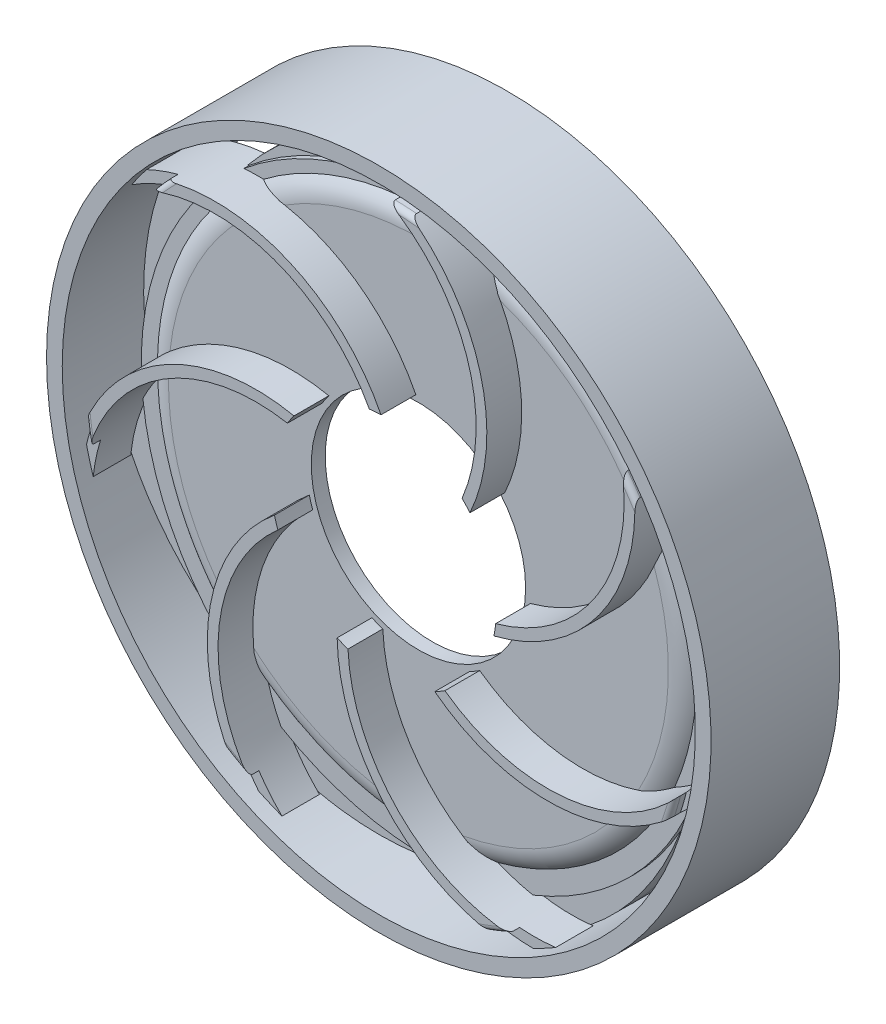
from build123d import *
from OCP.BRepFilletAPI import BRepFilletAPI_MakeChamfer
from build123d.topology import SkipClean

# Parameters (mm, degrees)
SKETCH1_R                 = 51
BOSS_EXTRUDE1_DEPTH       = 2.6
BOSS_EXTRUDE12_DEPTH      = 3.5
BOSS_EXTRUDE12_2_DEPTH    = 3.5
BOSS_EXTRUDE12_3_DEPTH    = 3.5
BOSS_EXTRUDE12_4_DEPTH    = 3.5
BOSS_EXTRUDE12_5_DEPTH    = 3.5
BOSS_EXTRUDE12_6_DEPTH    = 3.5
BOSS_EXTRUDE12_7_DEPTH    = 3.5
SKETCH17_R                = 51.58295431034159
SKETCH17_R_2              = 51.00000000000001
BOSS_EXTRUDE17_DEPTH      = 3.55
BOSS_EXTRUDE18_DEPTH      = 8
CIRPATTERN9_COUNT         = 7
CHAMFER4_SIZE             = 8
CHAMFER4_SIZE_2           = 6
FILLET2_R                 = 5
BOSS_EXTRUDE19_DEPTH      = 2.5
BOSS_EXTRUDE19_DEPTH_BACK = 21.5
SKETCH19_R                = 62
SKETCH19_R_2              = 59.070129845213785
SKETCH20_R                = 20
CUT_EXTRUDE2_DEPTH        = 90.23878082605118
BOSS_EXTRUDE20_DEPTH      = 6.5
CIRPATTERN10_COUNT        = 7
BOSS_EXTRUDE21_DEPTH      = 3.5
CIRPATTERN11_COUNT        = 7
BOSS_EXTRUDE22_START      = -9.1
BOSS_EXTRUDE22_DEPTH      = 9.1
CIRPATTERN13_COUNT        = 7
SKETCH24_R                = 21.00534667736599
CUT_EXTRUDE3_DEPTH        = 12.6
CUT_EXTRUDE4_START        = -3
SKETCH25_R                = 59.070129845213785
SKETCH25_R_2              = 56.070129845213785
CUT_EXTRUDE4_DEPTH        = 3
FILLET3_R                 = 1
SKETCH26_R                = 52
CUT_EXTRUDE5_DEPTH        = 30
BOSS_EXTRUDE23_START      = -1
SKETCH27_R                = 53.32091751756544
SKETCH27_R_2              = 20
BOSS_EXTRUDE23_DEPTH      = 1


# Some blends are built 0.0001 mm under size
with BuildPart() as part:
    # Sketch1 → Boss-Extrude1 (new body)
    with BuildSketch(Plane.XY):
        Circle(SKETCH1_R)
    extrude(amount=BOSS_EXTRUDE1_DEPTH)



with BuildPart() as body_2:
    # Sketch13 → Boss-Extrude12 (new body)
    with BuildSketch(Plane(origin=(0, 0, 0), x_dir=(-1, 0, 0), z_dir=(0, 0, -1))):
        with BuildLine():
            ThreePointArc((-39.87340560586933, 31.797979894795645), (-22.128070694995337, 45.94941226302344), (3.12e-15, 51))
            add(Edge.make_bspline(
                [(0, 51), (-16.32188038629084, 53.8593825091432), (-34.590722993589566, 48.68202255750877), (-46.51897320684779, 37.097643210594654)],
                knots=[0, 0, 0, 0, 1, 1, 1, 1], degree=3))
            Line((-46.51897320684732, 37.097643210595216), (-39.873405605869145, 31.797979894795866))
        make_face()
    extrude(amount=BOSS_EXTRUDE12_DEPTH)


with BuildPart() as body_3:
    # Sketch13 → Boss-Extrude12 2 (new body)
    with BuildSketch(Plane(origin=(0, 0, 0), x_dir=(-1, 0, 0), z_dir=(0, 0, -1))):
        with BuildLine():
            ThreePointArc((-49.72132352127312, -11.348567631771543), (-49.721323521272915, 11.348567631772438), (-39.87340560586933, 31.797979894795645))
            add(Edge.make_bspline(
                [(-39.873405605869515, 31.797979894795407), (-52.2854868399465, 20.81981578977977), (-59.62810089110262, 3.308628360744432), (-58.00821077481851, -13.23999557040073)],
                knots=[0, 0, 0, 0, 1, 1, 1, 1], degree=3))
            Line((-58.00821077481851, -13.23999557040073), (-49.72132352127312, -11.348567631771548))
        make_face()
    extrude(amount=BOSS_EXTRUDE12_2_DEPTH)


with BuildPart() as body_4:
    # Sketch13 → Boss-Extrude12 3 (new body)
    with BuildSketch(Plane(origin=(0, 0, 0), x_dir=(-1, 0, 0), z_dir=(0, 0, -1))):
        with BuildLine():
            ThreePointArc((-22.128070694995838, -45.9494122630232), (-39.873405605869806, -31.797979894795052), (-49.72132352127312, -11.348567631771543))
            add(Edge.make_bspline(
                [(-49.72132352127312, -11.348567631771548), (-48.87705527356048, -27.897496866132563), (-39.76430262602292, -44.5562304753792), (-25.816082477494696, -53.60764764019395)],
                knots=[0, 0, 0, 0, 1, 1, 1, 1], degree=3))
            Line((-25.816082477495144, -53.60764764019375), (-22.128070694995838, -45.9494122630232))
        make_face()
    extrude(amount=BOSS_EXTRUDE12_3_DEPTH)


with BuildPart() as body_5:
    # Sketch13 → Boss-Extrude12 4 (new body)
    with BuildSketch(Plane(origin=(0, 0, 0), x_dir=(-1, 0, 0), z_dir=(0, 0, -1))):
        with BuildLine():
            ThreePointArc((22.12807069499517, -45.94941226302352), (-3.7175e-13, -51), (-22.128070694995838, -45.9494122630232))
            add(Edge.make_bspline(
                [(-22.128070694995838, -45.9494122630232), (-8.663204175954887, -55.607425376619254), (10.0428265604032, -58.86933898207705), (25.816082477494724, -53.60764764019394)],
                knots=[0, 0, 0, 0, 1, 1, 1, 1], degree=3))
            Line((25.81608247749438, -53.60764764019411), (22.128070694995195, -45.949412263023504))
        make_face()
    extrude(amount=BOSS_EXTRUDE12_4_DEPTH)


with BuildPart() as body_6:
    # Sketch13 → Boss-Extrude12 5 (new body)
    with BuildSketch(Plane(origin=(0, 0, 0), x_dir=(-1, 0, 0), z_dir=(0, 0, -1))):
        with BuildLine():
            Line((58.008210774818465, -13.239995570400941), (49.721323521272964, -11.348567631772214))
            ThreePointArc((49.72132352127296, -11.348567631772223), (39.873405605869344, -31.797979894795628), (22.12807069499517, -45.94941226302352))
            add(Edge.make_bspline(
                [(22.128070694995195, -45.949412263023504), (38.074216363304764, -41.443828393752625), (52.287502510517676, -28.852634519600436), (58.00821077481852, -13.239995570400698)],
                knots=[0, 0, 0, 0, 1, 1, 1, 1], degree=3))
        make_face()
    extrude(amount=BOSS_EXTRUDE12_5_DEPTH)


with BuildPart() as body_7:
    # Sketch13 → Boss-Extrude12 6 (new body)
    with BuildSketch(Plane(origin=(0, 0, 0), x_dir=(-1, 0, 0), z_dir=(0, 0, -1))):
        with BuildLine():
            Line((46.51897320684786, 37.09764321059457), (39.87340560586958, 31.797979894795333))
            ThreePointArc((39.873405605869586, 31.797979894795333), (48.13804984572676, 16.844232159713474), (51, 0))
            ThreePointArc((51, -1.249e-14), (50.67932270455536, -5.710188281268803), (49.72132352127296, -11.348567631772223))
            add(Edge.make_bspline(
                [(49.721323521272964, -11.348567631772214), (56.14097540852166, 3.9278166696430006), (55.1586225995381, 22.89069222262075), (46.51897320684778, 37.09764321059466)],
                knots=[0, 0, 0, 0, 1, 1, 1, 1], degree=3))
        make_face()
    extrude(amount=BOSS_EXTRUDE12_6_DEPTH)


with BuildPart() as body_8:
    # Sketch13 → Boss-Extrude12 7 (new body)
    with BuildSketch(Plane(origin=(0, 0, 0), x_dir=(-1, 0, 0), z_dir=(0, 0, -1))):
        with BuildLine():
            Line((0, 59.500000000000014), (0, 51))
            ThreePointArc((3.12e-15, 51), (22.128070694995507, 45.949412263023355), (39.87340560586958, 31.79797989479534))
            add(Edge.make_bspline(
                [(39.87340560586958, 31.797979894795333), (31.932434903925515, 46.34173566793887), (16.494174840255635, 57.396860836182455), (-4.48e-15, 59.50000000000002)],
                knots=[0, 0, 0, 0, 1, 1, 1, 1], degree=3))
        make_face()
    extrude(amount=BOSS_EXTRUDE12_7_DEPTH)


with BuildPart() as part_1:
    with SkipClean():  # the faces are left unmerged after this step: merging them gives an invalid solid
        add(part.part)

        add(body_2.part)  # Boss-Extrude17 merges body 2

        add(body_3.part)  # Boss-Extrude17 merges body 3

        add(body_4.part)  # Boss-Extrude17 merges body 4

        add(body_5.part)  # Boss-Extrude17 merges body 5

        add(body_6.part)  # Boss-Extrude17 merges body 6

        add(body_7.part)  # Boss-Extrude17 merges body 7

        add(body_8.part)  # Boss-Extrude17 merges body 8
        # Sketch17 → Boss-Extrude17 (add)
        with BuildSketch(Plane(origin=(0, 0, -3.5), x_dir=(-1, 0, 0), z_dir=(0, 0, -1))):
            Circle(SKETCH17_R)
            Circle(SKETCH17_R_2, mode=Mode.SUBTRACT)
        extrude(amount=-BOSS_EXTRUDE17_DEPTH)

    # Sketch18 → Boss-Extrude18 (add)
    with BuildSketch(Plane(origin=(0, 0, -3.5), x_dir=(-1, 0, 0), z_dir=(0, 0, -1))):
        with BuildLine():
            Line((0, 59.500000000000014), (-2.05063e-12, 57.98744126944187))
            add(Edge.make_bspline(
                [(33.94539366621237, 38.0618325653946), (33.82404044165901, 38.216608033428244), (32.523438247504394, 39.85519845340849), (28.572533583380146, 44.27197439101665), (21.106987449954232, 50.36809653447095), (10.92043121497604, 55.61865439476778), (3.6625209468101008, 57.504539351810116), (-2.05063e-12, 57.98744126944187)],
                knots=[0.1725549864477582, 0.1725549864477582, 0.1725549864477582, 0.1725549864477582, 0.18464855247280693, 0.30112733069097736, 0.5340848871273183, 0.7670424435636591, 0.9960468956387994, 0.9960468956387994, 0.9960468956387994, 0.9960468956387994], degree=3))
            ThreePointArc((33.94539366621237, 38.0618325653946), (35.843159065149386, 36.28030867592866), (37.64755641777565, 34.40427800667621))
            Line((37.64755641777565, 34.40427800667621), (38.146921280088144, 34.721946550179865))
            add(Edge.make_bspline(
                [(38.146921280088144, 34.721946550179865), (29.822682536382537, 47.80738550570229), (15.369770664878905, 57.54023135820599), (0, 59.500000000000014)],
                knots=[0.06816977425463647, 0.06816977425463647, 0.06816977425463647, 0.06816977425463647, 1, 1, 1, 1], degree=3))
        make_face()
    boss_extrude18 = extrude(amount=BOSS_EXTRUDE18_DEPTH)

    # CirPattern9: Boss-Extrude18 ×7 about axis
    cirpattern9_axis = Axis((0, 0, -3.5), (0, 0, -1))
    for i in range(1, CIRPATTERN9_COUNT):
        add(boss_extrude18.rotate(cirpattern9_axis, i * 360 / CIRPATTERN9_COUNT))

    # Chamfer4
    chamfer4_edges_1 = [part_1.edges().sort_by_distance(p)[0] for p in [
        (49.14060477325408, -14.697292446673746, -11.5),
    ]]
    chamfer4_side_1 = [part_1.faces().sort_by_distance(p)[0] for p in [
        (49.14060477325408, -14.697292446673746, -11.38),
    ]]
    chamfer4_edges_2 = [part_1.edges().sort_by_distance(p)[0] for p in [
        (42.129471875143636, 29.256059923812305, -11.5),
    ]]
    chamfer4_side_2 = [part_1.faces().sort_by_distance(p)[0] for p in [
        (42.129471875143636, 29.256059923812305, -11.38),
    ]]
    chamfer4_edges_3 = [part_1.edges().sort_by_distance(p)[0] for p in [
        (3.3939873704387082, 51.17900245680369, -11.5),
    ]]
    chamfer4_side_3 = [part_1.faces().sort_by_distance(p)[0] for p in [
        (3.3939873704387082, 51.17900245680369, -11.38),
    ]]
    chamfer4_edges_4 = [part_1.edges().sort_by_distance(p)[0] for p in [
        (-37.89723884893189, 34.56311227842804, -11.5),
    ]]
    chamfer4_side_4 = [part_1.faces().sort_by_distance(p)[0] for p in [
        (-37.89723884893189, 34.56311227842804, -11.38),
    ]]
    chamfer4_edges_5 = [part_1.edges().sort_by_distance(p)[0] for p in [
        (-50.65107125226599, -8.079506404607187, -11.5),
    ]]
    chamfer4_side_5 = [part_1.faces().sort_by_distance(p)[0] for p in [
        (-50.65107125226599, -8.079506404607187, -11.38),
    ]]
    chamfer4_edges_6 = [part_1.edges().sort_by_distance(p)[0] for p in [
        (-25.263613909083986, -44.638091973077806, -11.5),
    ]]
    chamfer4_side_6 = [part_1.faces().sort_by_distance(p)[0] for p in [
        (-25.263613909083986, -44.638091973077806, -11.38),
    ]]
    chamfer4_edges_7 = [part_1.edges().sort_by_distance(p)[0] for p in [
        (19.147859991445408, -47.583283834685254, -11.5),
    ]]
    chamfer4_side_7 = [part_1.faces().sort_by_distance(p)[0] for p in [
        (19.147859991445408, -47.583283834685254, -11.38),
    ]]
    chamfer4 = BRepFilletAPI_MakeChamfer(part_1.part.solid().wrapped)
    for e in chamfer4_edges_1:
        chamfer4.Add(CHAMFER4_SIZE - 0.0001, CHAMFER4_SIZE_2 - 0.0001, e.wrapped, chamfer4_side_1[0].wrapped)
    for e in chamfer4_edges_2:
        chamfer4.Add(CHAMFER4_SIZE - 0.0001, CHAMFER4_SIZE_2 - 0.0001, e.wrapped, chamfer4_side_2[0].wrapped)
    for e in chamfer4_edges_3:
        chamfer4.Add(CHAMFER4_SIZE - 0.0001, CHAMFER4_SIZE_2 - 0.0001, e.wrapped, chamfer4_side_3[0].wrapped)
    for e in chamfer4_edges_4:
        chamfer4.Add(CHAMFER4_SIZE - 0.0001, CHAMFER4_SIZE_2 - 0.0001, e.wrapped, chamfer4_side_4[0].wrapped)
    for e in chamfer4_edges_5:
        chamfer4.Add(CHAMFER4_SIZE - 0.0001, CHAMFER4_SIZE_2 - 0.0001, e.wrapped, chamfer4_side_5[0].wrapped)
    for e in chamfer4_edges_6:
        chamfer4.Add(CHAMFER4_SIZE - 0.0001, CHAMFER4_SIZE_2 - 0.0001, e.wrapped, chamfer4_side_6[0].wrapped)
    for e in chamfer4_edges_7:
        chamfer4.Add(CHAMFER4_SIZE - 0.0001, CHAMFER4_SIZE_2 - 0.0001, e.wrapped, chamfer4_side_7[0].wrapped)
    add(Compound.cast(chamfer4.Shape()), mode=Mode.REPLACE)  # a hair under: the kernel refuses the full size

    # Fillet2
    # the kernel refuses this fillet: 5 mm, written as the material it takes off along each edge
    with BuildSketch(Plane(origin=(0, 0, 2.6), x_dir=(1, 0, 0), z_dir=(0, -1, 0))) as fillet2_piece_1:
        with BuildLine():
            CenterArc((46.641387835560366, -5), FILLET2_R, 29.34058157502301, 60.65941842497699)
            Line((46.641387835560366, 0), (46.641387835560366, 0.10000000000000009))
            Line((46.641387835560366, 0.10000000000000009), (51, 0.10000000000000009))
            Line((51, 0.10000000000000009), (51.1, 0))
            ThreePointArc((51.1, 0), (51.1, -1.275000000000027), (51.08717224328869, -2.501000000000055))
            Line((51.08717224328869, -2.501000000000055), (50.9999999999999, -2.550000000000054))
        make_face()
    revolve(axis=Axis((0, 0, 2.6), (0, 0, 1)), mode=Mode.SUBTRACT)

    # Sketch19 → Boss-Extrude19 (add, two sides: drawn at the far end of the back side and taken through both)
    with BuildSketch(Plane(origin=(0, 0, -11.5), x_dir=(-1, 0, 0), z_dir=(0, 0, -1)).offset(-BOSS_EXTRUDE19_DEPTH_BACK)):
        Circle(SKETCH19_R)
        Circle(SKETCH19_R_2, mode=Mode.SUBTRACT)
    extrude(amount=BOSS_EXTRUDE19_DEPTH + BOSS_EXTRUDE19_DEPTH_BACK)

    # Sketch20 → Cut-Extrude2 (cut, through all)
    with BuildSketch(Plane.XY.offset(2.6)):
        Circle(SKETCH20_R)
    extrude(amount=-CUT_EXTRUDE2_DEPTH, mode=Mode.SUBTRACT)

    # Sketch21 → Boss-Extrude20 (add)
    with BuildSketch(Plane.XY.offset(2.6)):
        with BuildLine():
            ThreePointArc((0, 20), (-19.68784193927231, 37.97748843024995), (-46.31621419538123, 36.661813137622964))
            ThreePointArc((-46.31621419538123, 36.661813137622964), (-47.75388666208768, 34.76847061052443), (-49.11421132589328, 32.81881298532768))
            ThreePointArc((-49.11421132589328, 32.81881298532768), (-22.745613294327512, 36.85054617488235), (-2.1628457408942983, 19.882708525276318))
            ThreePointArc((-2.1628457408942983, 19.882708525276318), (-1.0830118869323917, 19.970655603979633), (0, 20))
        make_face()
    boss_extrude20 = extrude(amount=BOSS_EXTRUDE20_DEPTH)

    # CirPattern10: Boss-Extrude20 ×7 about axis
    with SkipClean():  # the faces are left unmerged after this step: merging them gives an invalid solid
        cirpattern10_axis = Axis((0, 0, 0), (0, 0, 1))
        for i in range(1, CIRPATTERN10_COUNT):
            add(boss_extrude20.rotate(cirpattern10_axis, i * 360 / CIRPATTERN10_COUNT))

    # Sketch22 → Boss-Extrude21 (add)
    with SkipClean():  # the faces are left unmerged after this step: merging them gives an invalid solid
        with BuildSketch(Plane(origin=(0, 0, -3.5), x_dir=(-1, 0, 0), z_dir=(0, 0, -1))):
            with BuildLine():
                Line((39.87340560586974, 31.79797989479513), (45.336407172213825, 36.15457826738144))
                Line((45.336407172213825, 36.15457826738144), (46.10019125831346, 36.76367575089608))
                ThreePointArc((46.10019125831346, 36.76367575089608), (39.031127137745464, 39.17885863262137), (31.60877843095007, 40.02355713955352))
                ThreePointArc((31.60877843095007, 40.02355713955352), (35.97694663143074, 36.147742821360005), (39.87340560586974, 31.79797989479513))
            make_face()
        boss_extrude21 = extrude(amount=-BOSS_EXTRUDE21_DEPTH)

    # CirPattern11: Boss-Extrude21 ×7 about axis
    with SkipClean():  # the faces are left unmerged after this step: merging them gives an invalid solid
        cirpattern11_axis = Axis((0, 0, 0), (0, 0, 1))
        for i in range(1, CIRPATTERN11_COUNT):
            add(boss_extrude21.rotate(cirpattern11_axis, i * 360 / CIRPATTERN11_COUNT))

    # Sketch23 → Boss-Extrude22 (add)
    with SkipClean():  # the faces are left unmerged after this step: merging them gives an invalid solid
        with BuildSketch(Plane.XY.offset(9.1).offset(BOSS_EXTRUDE22_START)):
            with BuildLine():
                Line((44.40621191345378, 16.57724091449077), (43.297755592693, 19.39334502128297))
                ThreePointArc((43.297755592693, 19.39334502128297), (44.876918460838986, 30.01771425785396), (42.92491699883642, 40.57994258957767))
                ThreePointArc((42.92491699883642, 40.57994258957767), (44.522991922165055, 38.81988446955042), (46.04895217913949, 36.996949105753856))
                ThreePointArc((46.04895217913949, 36.996949105753856), (46.77033416109151, 26.662982510805122), (44.40621191345378, 16.57724091449077))
            make_face()
        boss_extrude22 = extrude(amount=BOSS_EXTRUDE22_DEPTH)

    # CirPattern13: Boss-Extrude22 ×7 about axis
    with SkipClean():  # the faces are left unmerged after this step: merging them gives an invalid solid
        cirpattern13_axis = Axis((6.45e-15, -2.588e-14, 0), (0, 0, 1))
        for i in range(1, CIRPATTERN13_COUNT):
            add(boss_extrude22.rotate(cirpattern13_axis, i * 360 / CIRPATTERN13_COUNT))

    # Sketch24 → Cut-Extrude3 (cut)
    with BuildSketch(Plane.XY.offset(2.6)):
        Circle(SKETCH24_R)
    extrude(amount=CUT_EXTRUDE3_DEPTH, mode=Mode.SUBTRACT)

    # Sketch25 → Cut-Extrude4 (cut)
    with BuildSketch(Plane.XY.offset(9.999999999999998).offset(CUT_EXTRUDE4_START)):
        with Locations(Location((0, 0, 0), (0, 0, 180))):
            Circle(SKETCH25_R)
        Circle(SKETCH25_R_2, mode=Mode.SUBTRACT)
    extrude(amount=CUT_EXTRUDE4_DEPTH, mode=Mode.SUBTRACT)

    # Fillet3
    fillet3_edges = [part_1.edges().sort_by_distance(p)[0] for p in [
        (3.155188062113431, 55.98128481154957, 9.1),
        (-41.800703315004654, 37.370585535017945, 9.1),
        (-55.27981251696936, -9.380926870403133, 9.1),
        (-27.132095390981707, -49.06841000637582, 9.1),
        (21.446642958298497, -51.806379594393576, 9.1),
        (53.875621728190744, -15.53308869027775, 9.1),
        (45.735158474352914, 32.43693481488284, 9.1),
    ]]
    fillet(fillet3_edges, radius=FILLET3_R)

    # Sketch26 → Cut-Extrude5 (cut)
    with BuildSketch(Plane(origin=(0, 0, 0), x_dir=(-1, 0, 0), z_dir=(0, 0, -1))):
        with Locations(Location((0, 0, 0), (0, 0, 199.255082051))):
            Circle(SKETCH26_R)
    extrude(amount=CUT_EXTRUDE5_DEPTH, mode=Mode.SUBTRACT)

    # Sketch27 → Boss-Extrude23 (add)
    with BuildSketch(Plane(origin=(0, 0, 0), x_dir=(-1, 0, 0), z_dir=(0, 0, -1)).offset(BOSS_EXTRUDE23_START)):
        with Locations((0, -1.0126126615500193)):
            Circle(SKETCH27_R)
        with Locations(Location((0, 0, 0), (0, 0, 180))):
            Circle(SKETCH27_R_2, mode=Mode.SUBTRACT)
    extrude(amount=BOSS_EXTRUDE23_DEPTH)


solid = part_1.part
